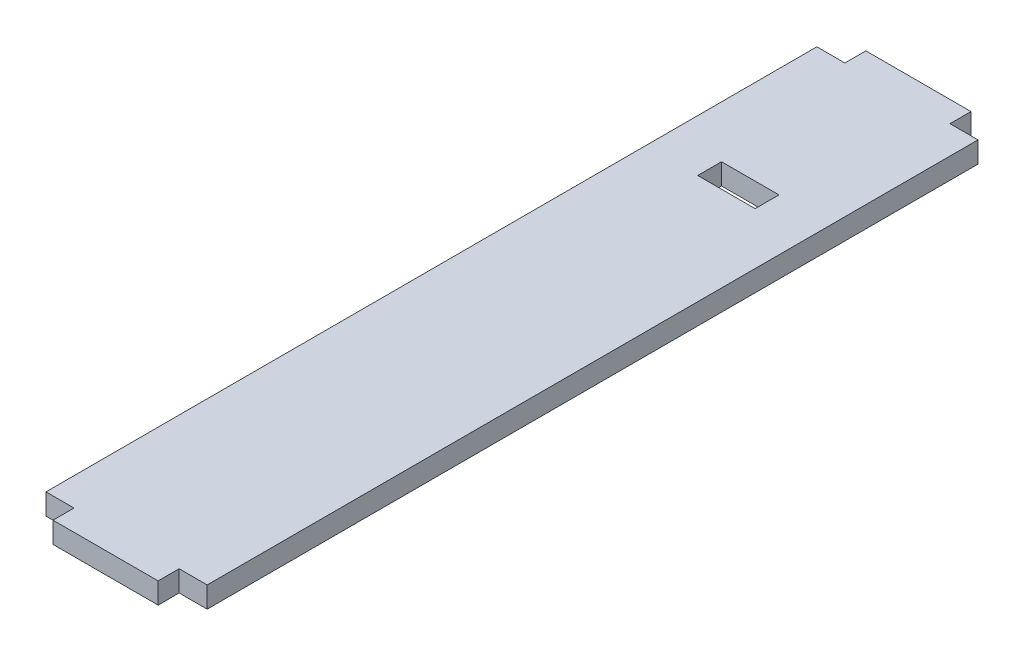
from build123d import *

# Parameters (mm, degrees)
SKETCH1_W           = 4.1
SKETCH1_H           = 1.7
BOSS_EXTRUDE1_DEPTH = 1.5


with BuildPart() as part:
    # Sketch1 → Boss-Extrude1 (new body)
    with BuildSketch(Plane(origin=(0, 0, 0), x_dir=(1, 0, 0), z_dir=(0, 1, 0))):
        Polygon((3.75, 27.5), (5.75, 27.5), (5.75, -12.4), (5.75, -14.1), (5.75, -27.5), (3.75, -27.5), (3.75, -29), (-3.75, -29), (-3.75, -27.5), (-5.75, -27.5), (-5.75, -16.6), (-5.75, -14.9), (-5.75, 27.5), (-3.75, 27.5), (-3.75, 29), (3.75, 29), align=None)
        with Locations((0, 16.15)):
            Rectangle(SKETCH1_W, SKETCH1_H, mode=Mode.SUBTRACT)
    extrude(amount=BOSS_EXTRUDE1_DEPTH)


solid = part.part
